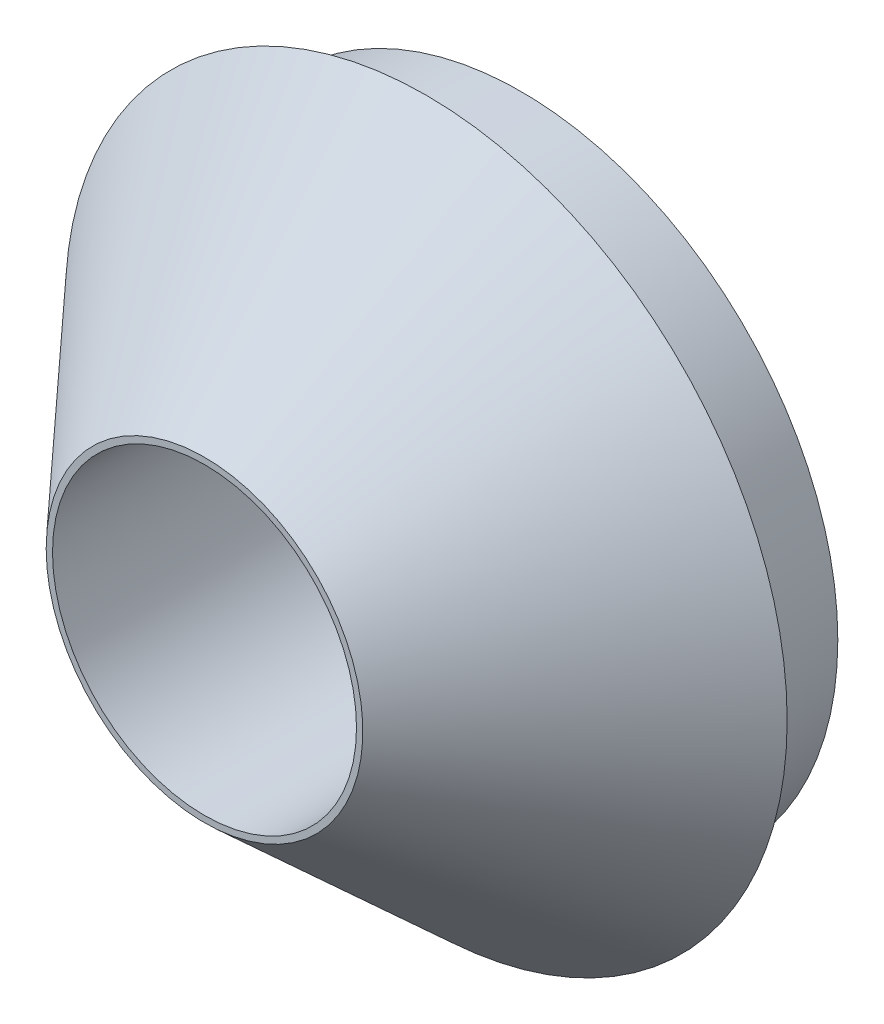
from build123d import *

# Parameters (mm, degrees)
SKETCH2_R          = 6.096
CUT_EXTRUDE1_DEPTH = 12.7


with BuildPart() as part:
    # Sketch1 → Revolve1 (revolve)
    with BuildSketch(Plane(origin=(0, 0, 0), x_dir=(1, 0, 0), z_dir=(0, 1, 0))):
        Polygon((0, 0), (6.35, 0), (14.478, 8.89), (12.7, 8.89), (12.7, 12.7), (0, 12.7), align=None)
    revolve(axis=Axis((0, 0, -12.7), (0, 0, 1)))

    # Sketch2 → Cut-Extrude1 (cut)
    with BuildSketch(Plane(origin=(0, 0, -12.7), x_dir=(-1, 0, 0), z_dir=(0, 0, -1))):
        Circle(SKETCH2_R)
    extrude(amount=-CUT_EXTRUDE1_DEPTH, mode=Mode.SUBTRACT)


solid = part.part
